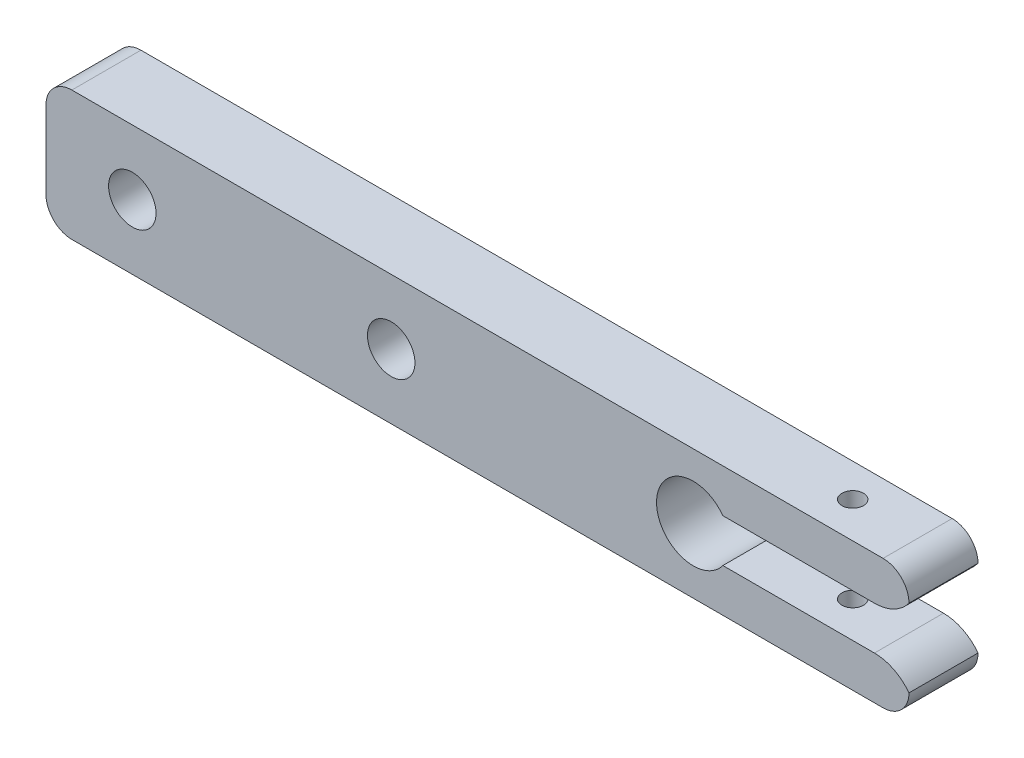
from build123d import *

# Parameters (mm, degrees)
SKIZZE1_W                       = 100
SKIZZE1_H                       = 15
SKIZZE1_R                       = 2.75
SKIZZE1_R_2                     = 4.25
AUFSATZ_LINEAR_AUSTRAGEN1_DEPTH = 8
VERRUNDUNG1_R                   = 3
SCHNITT_LINEAR_AUSTRAGEN1_DEPTH = 30
M3_GEWINDEBOHRUNG1_D            = 2.5
VERRUNDUNG2_R                   = 5


with BuildPart() as part:
    # Skizze1 → Aufsatz-Linear austragen1 (new body)
    with BuildSketch(Plane.XY):
        Rectangle(SKIZZE1_W, SKIZZE1_H)
        with Locations((-10, 0)):
            Circle(SKIZZE1_R, mode=Mode.SUBTRACT)
        with Locations((-40, 0)):
            Circle(SKIZZE1_R, mode=Mode.SUBTRACT)
        with Locations((25, 0)):
            Circle(SKIZZE1_R_2, mode=Mode.SUBTRACT)
    extrude(amount=AUFSATZ_LINEAR_AUSTRAGEN1_DEPTH)

    # Verrundung1
    verrundung1_edges = [part.edges().sort_by_distance(p)[0] for p in [
        (-50, 7.5, 4),
        (50, 7.5, 4),
        (50, -7.5, 4),
        (-50, -7.5, 4),
    ]]
    fillet(verrundung1_edges, radius=VERRUNDUNG1_R)

    # Skizze2 → Schnitt-Linear austragen1 (cut)
    with BuildSketch(Plane.XY.offset(8)):
        with BuildLine():
            Line((25, 2.5), (52.731650319, 2.5))
            ThreePointArc((52.731650319, 2.5), (55.231650319, 0), (52.731650319, -2.5))
            Line((52.731650319, -2.5), (25, -2.5))
            ThreePointArc((25, -2.5), (22.5, 0), (25, 2.5))
        make_face()
    extrude(amount=-SCHNITT_LINEAR_AUSTRAGEN1_DEPTH, mode=Mode.SUBTRACT)

    # M3 Gewindebohrung1 (through all)
    with Locations(Plane.XZ.offset(7.5)):
        with Locations((39.324789102, 3.845615986)):
            Hole(M3_GEWINDEBOHRUNG1_D / 2)

    # Verrundung2
    # the kernel refuses this fillet: 5 mm, written as the material it takes off along each edge
    with BuildSketch(Plane(origin=(50, -2.5, 18), x_dir=(-1, 0, 0), z_dir=(0, 0, -1))) as verrundung2_piece_1:
        with BuildLine():
            CenterArc((4, -5), VERRUNDUNG2_R, 90, 53.130102354)
            Line((0, -2), (-0.08, -1.94))
            ThreePointArc((-0.08, -1.94), (-0.1, -1), (-0.1, 0))
            Line((-0.1, 0), (0, 0.1))
            Line((0, 0.1), (4, 0.1))
            Line((4, 0.1), (4, 0))
        make_face()
    extrude(amount=28, mode=Mode.SUBTRACT)
    with BuildSketch(Plane(origin=(50, 2.5, -10), x_dir=(0, 1, 0), z_dir=(0, 0, 1))) as verrundung2_piece_2:
        with BuildLine():
            CenterArc((5, 4), VERRUNDUNG2_R, 180, 53.130102354)
            Line((0, 4), (-0.1, 4))
            Line((-0.1, 4), (-0.1, 0))
            Line((-0.1, 0), (0, -0.1))
            ThreePointArc((0, -0.1), (1, -0.1), (1.94, -0.08))
            Line((1.94, -0.08), (2, 0))
        make_face()
    extrude(amount=28, mode=Mode.SUBTRACT)


solid = part.part
